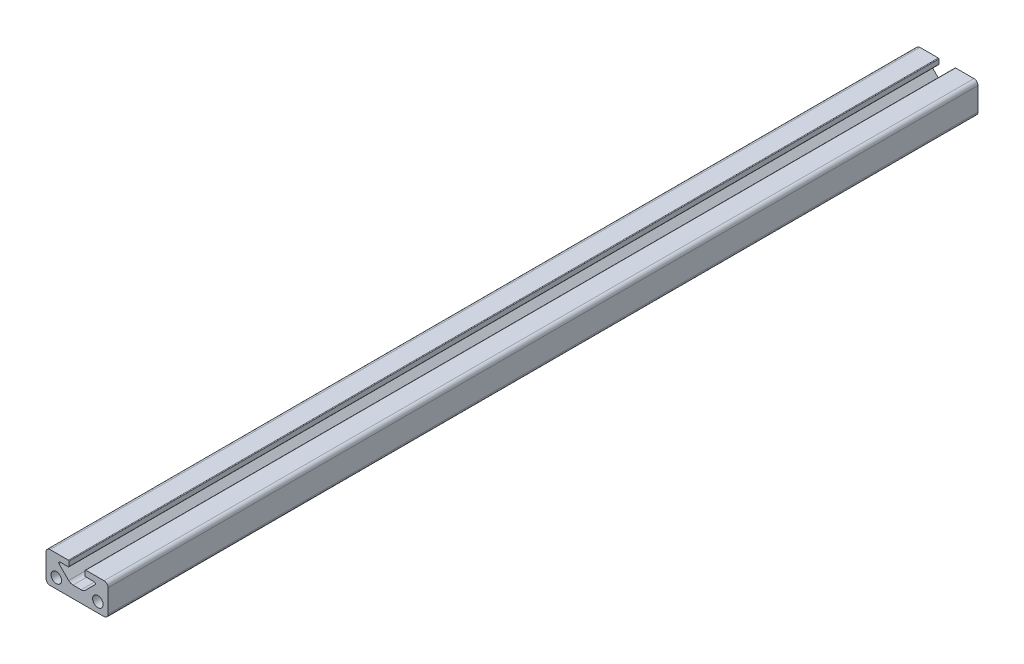
from build123d import *

# Parameters (mm, degrees)
SKETCH3_R           = 2.1463
BOSS_EXTRUDE1_DEPTH = 177.8
FILLET1_R           = 0.254


with BuildPart() as part:
    # Sketch3 → Boss-Extrude1 (new, symmetric)
    with BuildSketch(Plane.XY):
        with BuildLine():
            Line((-11.049, 12.7), (-3.302, 12.7))
            Line((-3.302, 12.7), (-3.302, 10.328863887))
            Line((-3.302, 10.328863887), (-6.985, 10.328863887))
            ThreePointArc((-6.985, 10.328863887), (-7.454330803, 10.01526707), (-7.344210245, 9.461653642))
            Line((-7.344210245, 9.461653642), (-3.452505379, 5.569948776))
            ThreePointArc((-3.452505379, 5.569948776), (-2.628470073, 5.019345987), (-1.656454155, 4.826))
            Line((-1.656454155, 4.826), (1.656454155, 4.826))
            ThreePointArc((1.656454155, 4.826), (2.628470073, 5.019345987), (3.452505379, 5.569948776))
            Line((3.452505379, 5.569948776), (7.344210245, 9.461653642))
            ThreePointArc((7.344210245, 9.461653642), (7.454330803, 10.01526707), (6.985, 10.328863887))
            Line((6.985, 10.328863887), (3.302, 10.328863887))
            Line((3.302, 10.328863887), (3.302, 12.7))
            Line((3.302, 12.7), (11.049, 12.7))
            ThreePointArc((11.049, 12.7), (12.216433296, 12.216433296), (12.7, 11.049))
            Line((12.7, 11.049), (12.7, 1.651))
            ThreePointArc((12.7, 1.651), (12.216433296, 0.483566704), (11.049, 0))
            Line((11.049, 0), (-11.049, 0))
            ThreePointArc((-11.049, 0), (-12.216433296, 0.483566704), (-12.7, 1.651))
            Line((-12.7, 1.651), (-12.7, 11.049))
            ThreePointArc((-12.7, 11.049), (-12.216433296, 12.216433296), (-11.049, 12.7))
        make_face()
        with Locations((8.509, 4.064)):
            Circle(SKETCH3_R, mode=Mode.SUBTRACT)
        with Locations((-8.509, 4.064)):
            Circle(SKETCH3_R, mode=Mode.SUBTRACT)
    extrude(amount=BOSS_EXTRUDE1_DEPTH, both=True)

    # Fillet1
    fillet1_edges = [part.edges().sort_by_distance(p)[0] for p in [
        (3.302, 10.328863887, 0),
        (3.302, 12.7, 0),
        (-3.302, 10.328863887, 0),
        (-3.302, 12.7, 0),
    ]]
    fillet(fillet1_edges, radius=FILLET1_R)


solid = part.part
